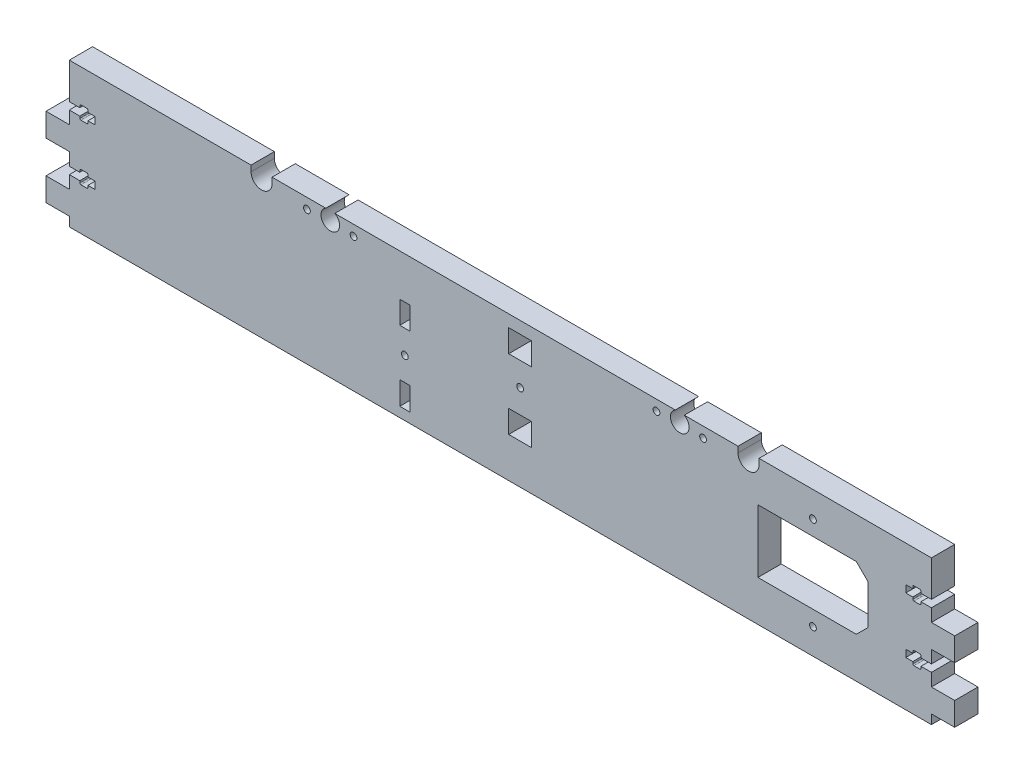
from build123d import *

# Parameters (mm, degrees)
MAINBODY_DEPTH      = 10
SCREWCUTOUTS_DEPTH  = 205.863369102
SKETCH2_R           = 4
SKETCH2_R_2         = 1.45
RODCUTOUTS_DEPTH    = 205.863369102
SKETCH4_R           = 1.45
SKETCH4_W           = 9.85
SKETCH4_H           = 9.7
CUT_EXTRUDE3_DEPTH  = 205.863369102
SKETCH5_R           = 1.45
SKETCH5_W           = 4.35
SKETCH5_H           = 9.7
SKETCH5_H_2         = 9.9
ENDSTOPHOLDER_DEPTH = 205.863369102
CUT_EXTRUDE4_DEPTH  = 205.863369102
CUT_EXTRUDE5_DEPTH  = 205.863369102
SKETCH9_R           = 1.45
CUT_EXTRUDE6_DEPTH  = 205.863369102


with BuildPart() as part:
    # Sketch1 → MainBody (new body)
    with BuildSketch(Plane.XY):
        Polygon((0, 0), (-185, 0), (-185, -24), (-195, -24), (-195, -34), (-185, -34), (-185, -48), (-195, -48), (-195, -58), (-185, -58), (-185, -62), (0, -62), align=None)
    mainbody = extrude(amount=MAINBODY_DEPTH)

    # Sketch3 → ScrewCutouts (cut, through all)
    with BuildSketch(Plane.XY.offset(10)):
        with BuildLine():
            Line((-185, -18.55), (-180.5, -18.55))
            Line((-180.5, -18.55), (-180.5, -19.35))
            ThreePointArc((-180.5, -19.35), (-180.353553391, -19.703553391), (-180, -19.85))
            Line((-180, -19.85), (-177.5, -19.85))
            ThreePointArc((-177.5, -19.85), (-177.146446609, -19.703553391), (-177, -19.35))
            Line((-177, -19.35), (-177, -18.55))
            Line((-177, -18.55), (-174, -18.55))
            Line((-174, -18.55), (-174, -15.45))
            Line((-174, -15.45), (-177, -15.45))
            Line((-177, -15.45), (-177, -14.65))
            ThreePointArc((-177, -14.65), (-177.146446609, -14.296446609), (-177.5, -14.15))
            Line((-177.5, -14.15), (-180, -14.15))
            ThreePointArc((-180, -14.15), (-180.353553391, -14.296446609), (-180.5, -14.65))
            Line((-180.5, -14.65), (-180.5, -15.45))
            Line((-180.5, -15.45), (-185, -15.45))
            Line((-185, -15.45), (-185, -18.55))
        make_face()
        with BuildLine():
            Line((-185, -39.45), (-185, -42.55))
            Line((-185, -42.55), (-180.5, -42.55))
            Line((-180.5, -42.55), (-180.5, -43.35))
            ThreePointArc((-180.5, -43.35), (-180.353553391, -43.703553391), (-180, -43.85))
            Line((-180, -43.85), (-177.5, -43.85))
            ThreePointArc((-177.5, -43.85), (-177.146446609, -43.703553391), (-177, -43.35))
            Line((-177, -43.35), (-177, -42.55))
            Line((-177, -42.55), (-174, -42.55))
            Line((-174, -42.55), (-174, -39.45))
            Line((-174, -39.45), (-177, -39.45))
            Line((-177, -39.45), (-177, -38.65))
            ThreePointArc((-177, -38.65), (-177.146446609, -38.296446609), (-177.5, -38.15))
            Line((-177.5, -38.15), (-180, -38.15))
            ThreePointArc((-180, -38.15), (-180.353553391, -38.296446609), (-180.5, -38.65))
            Line((-180.5, -38.65), (-180.5, -39.45))
            Line((-180.5, -39.45), (-185, -39.45))
        make_face()
    screwcutouts = extrude(amount=-SCREWCUTOUTS_DEPTH, mode=Mode.SUBTRACT)

    # Mirror1: MainBody, ScrewCutouts across plane
    add(mainbody.mirror(Plane(origin=(0, 0, 0), x_dir=(0, 0, 1), z_dir=(1, 0, 0))))
    add(screwcutouts.mirror(Plane(origin=(0, 0, 0), x_dir=(0, 0, 1), z_dir=(1, 0, 0))), mode=Mode.SUBTRACT)

    # Sketch2 → RodCutouts (cut, through all)
    with BuildSketch(Plane.XY.offset(10)):
        with Locations((-73, -3.5)):
            Circle(SKETCH2_R)
        with Locations((-83, -4.5)):
            Circle(SKETCH2_R_2)
        with Locations((-63, -4.5)):
            Circle(SKETCH2_R_2)
        with Locations((67, -4.5)):
            Circle(SKETCH2_R_2)
        with Locations((87, -4.5)):
            Circle(SKETCH2_R_2)
        with Locations((77, -3.5)):
            Circle(SKETCH2_R)
    extrude(amount=-RODCUTOUTS_DEPTH, mode=Mode.SUBTRACT)

    # Sketch4 → Cut-Extrude3 (cut, through all)
    with BuildSketch(Plane.XY.offset(10)):
        with Locations((8.5, -25)):
            Circle(SKETCH4_R)
        with Locations((8.5, -10)):
            Rectangle(SKETCH4_W, SKETCH4_H)
        with Locations((8.5, -40)):
            Rectangle(SKETCH4_W, SKETCH4_H)
    extrude(amount=-CUT_EXTRUDE3_DEPTH, mode=Mode.SUBTRACT)

    # Sketch5 → EndstopHolder (cut, through all)
    with BuildSketch(Plane.XY.offset(10)):
        with Locations((-41, -37.75)):
            Circle(SKETCH5_R)
        with Locations((-41, -22.8)):
            Rectangle(SKETCH5_W, SKETCH5_H)
        with Locations((-41, -52.8)):
            Rectangle(SKETCH5_W, SKETCH5_H_2)
        with BuildLine():
            Line((-31.425, 8.994431211), (-31.425, 5))
            ThreePointArc((-31.425, 5), (-34.625, 1.8), (-37.825, 5))
            Line((-37.825, 5), (-37.825, 8.994431211))
            ThreePointArc((-37.825, 8.994431211), (-34.625, 12.194431211), (-31.425, 8.994431211))
        make_face()
    extrude(amount=-ENDSTOPHOLDER_DEPTH, mode=Mode.SUBTRACT)

    # Sketch7 → Cut-Extrude4 (cut, through all)
    with BuildSketch(Plane.XY.offset(10)):
        with BuildLine():
            Line((-98, 0), (-98, -2.5))
            ThreePointArc((-98, -2.5), (-102.5, -7), (-107, -2.5))
            Line((-107, -2.5), (-107, 0))
            ThreePointArc((-107, 0), (-102.5, 4.5), (-98, 0))
        make_face()
        with BuildLine():
            Line((102, 0), (102, -2.5))
            ThreePointArc((102, -2.5), (106.5, -7), (111, -2.5))
            Line((111, -2.5), (111, 0))
            ThreePointArc((111, 0), (106.5, 4.5), (102, 0))
        make_face()
    extrude(amount=-CUT_EXTRUDE4_DEPTH, mode=Mode.SUBTRACT)

    # Sketch8 → Cut-Extrude5 (cut, through all)
    with BuildSketch(Plane.XY.offset(10)):
        Polygon((110.536074356, -17.485), (110.536074356, -44.515), (152.786074356, -44.515), (157.786074356, -39.515), (157.786074356, -22.485), (152.786074356, -17.485), align=None)
    extrude(amount=-CUT_EXTRUDE5_DEPTH, mode=Mode.SUBTRACT)

    # Sketch9 → Cut-Extrude6 (cut, through all)
    with BuildSketch(Plane(origin=(0, 0, 0), x_dir=(-1, 0, 0), z_dir=(0, 0, -1))):
        with Locations((-134.161074356, -11)):
            Circle(SKETCH9_R)
        with Locations((-134.161074356, -51)):
            Circle(SKETCH9_R)
    extrude(amount=-CUT_EXTRUDE6_DEPTH, mode=Mode.SUBTRACT)


solid = part.part
